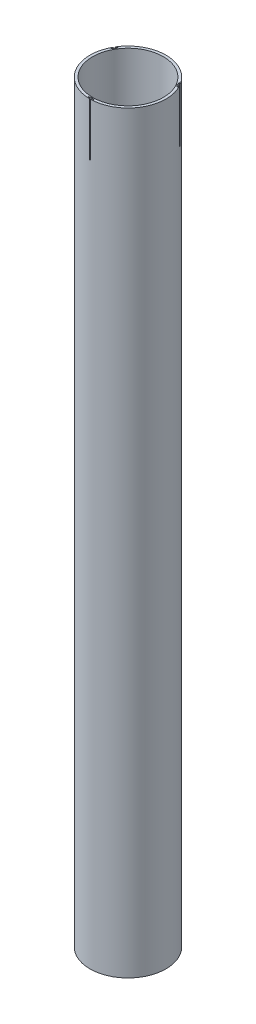
from build123d import *

# Parameters (mm, degrees)
SKETCH1_R           = 57.5
BOSS_EXTRUDE1_DEPTH = 570
SHELL1_T            = -4
CUT_EXTRUDE4_DEPTH  = 80
CIRPATTERN1_COUNT   = 3
BOSS_EXTRUDE3_START = -5
BOSS_EXTRUDE3_DEPTH = 5


with BuildPart() as part:
    # Sketch1 → Boss-Extrude1 (new, symmetric)
    with BuildSketch(Plane(origin=(0, 0, 0), x_dir=(1, 0, 0), z_dir=(0, 1, 0))):
        Circle(SKETCH1_R)
    extrude(amount=BOSS_EXTRUDE1_DEPTH, both=True)

    # Shell1
    shell1_openings = [part.faces().sort_by_distance(p)[0] for p in [
        (0, 570, 0),
        (0, -570, 0),
    ]]
    offset(amount=SHELL1_T, openings=shell1_openings, kind=Kind.INTERSECTION)

    # Sketch2 → Cut-Extrude4 (cut)
    with BuildSketch(Plane(origin=(0, 570, 0), x_dir=(1, 0, 0), z_dir=(0, 1, 0))):
        with BuildLine():
            Line((1, -57.49130369), (1, -56.50869631))
            Line((1, -56.50869631), (4, -56.50869631))
            Line((4, -56.50869631), (4, -55.50869631))
            Line((4, -55.50869631), (0, -54.50869631))
            Line((0, -54.50869631), (-4, -55.50869631))
            Line((-4, -55.50869631), (-4, -56.50869631))
            Line((-4, -56.50869631), (-1, -56.50869631))
            Line((-1, -56.50869631), (-1, -57.49130369))
            ThreePointArc((-1, -57.49130369), (0, -57.5), (1, -57.49130369))
        make_face()
    cut_extrude4 = extrude(amount=-CUT_EXTRUDE4_DEPTH, mode=Mode.SUBTRACT)

    # CirPattern1: Cut-Extrude4 ×3 about axis
    cirpattern1_axis = Axis((0, -777.474548335, 0), (0, 1, 0))
    for i in range(1, CIRPATTERN1_COUNT):
        add(cut_extrude4.rotate(cirpattern1_axis, i * 360 / CIRPATTERN1_COUNT), mode=Mode.SUBTRACT)

    # Sketch4 → Boss-Extrude3 (add)
    with BuildSketch(Plane(origin=(0, -570, 0), x_dir=(-1, 0, 0), z_dir=(0, -1, 0)).offset(BOSS_EXTRUDE3_START)):
        with BuildLine():
            Line((4.482088094, 53.311920677), (2.136322363, 25.410354715))
            ThreePointArc((2.136322363, 25.410354715), (-4.5131548, 25.097438789), (-10.855067921, 23.074173884))
            Line((-10.855067921, 23.074173884), (-22.774358187, 48.410521678))
            ThreePointArc((-22.774358187, 48.410521678), (-9.468775757, 52.655410792), (4.482088094, 53.311920677))
        make_face()
        with BuildLine():
            Line((-4.482088094, -53.311920677), (-2.136322363, -25.410354715))
            ThreePointArc((-2.136322363, -25.410354715), (4.5131548, -25.097438789), (10.855067921, -23.074173884))
            Line((10.855067921, -23.074173884), (22.774358187, -48.410521678))
            ThreePointArc((22.774358187, -48.410521678), (9.468775757, -52.655410792), (-4.482088094, -53.311920677))
        make_face()
    extrude(amount=BOSS_EXTRUDE3_DEPTH)


solid = part.part
